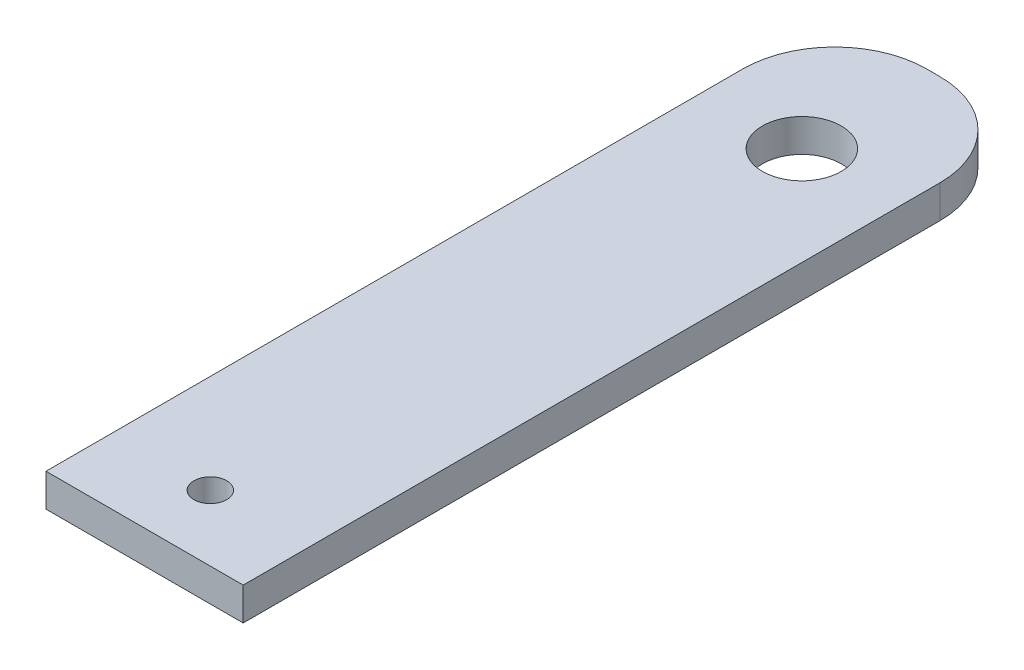
from build123d import *

# Parameters (mm, degrees)
STEM_START                = 1.006990195
STEM_OTHER_SIDE_OUTLINE_R = 3.81
STEM_OTHER_SIDE_DEPTH     = 3.175
SKETCH1_R                 = 1.5875
CUT_EXTRUDE1_DEPTH        = 3.175


# Read off the part's stored shape, not the designer's step: Stem Other Side
with BuildPart() as part:
    # Stem Other Side outline → Stem Other Side (new body)
    with BuildSketch(Plane(origin=(0, 0, 0), x_dir=(1, 0, 0), z_dir=(0, 1, 0)).offset(STEM_START)):
        with BuildLine():
            Line((-20.453203013, 27.656176961), (-21.723203013, 27.656176961))
            ThreePointArc((-21.723203013, 27.656176961), (-28.009382298, 25.052356246), (-30.613203013, 18.766176961))
            Line((-30.613203013, 18.766176961), (-30.613203013, -48.543823039))
            Line((-30.613203013, -48.543823039), (-11.563203013, -48.543823039))
            Line((-11.563203013, -48.543823039), (-11.563203013, 18.766176961))
            ThreePointArc((-11.563203013, 18.766176961), (-14.167023728, 25.052356246), (-20.453203013, 27.656176961))
        make_face()
        with Locations((-21.088203013, 14.956176961)):
            Circle(STEM_OTHER_SIDE_OUTLINE_R, mode=Mode.SUBTRACT)
    extrude(amount=STEM_OTHER_SIDE_DEPTH)

    # Sketch1 → Cut-Extrude1 (cut)
    with BuildSketch(Plane(origin=(0, 4.181990195, 0), x_dir=(1, 0, 0), z_dir=(0, 1, 0))):
        with Locations(Location((-21.088203013, -42.193823039, 0), (0, 0, 270))):
            Circle(SKETCH1_R)
    extrude(amount=-CUT_EXTRUDE1_DEPTH, mode=Mode.SUBTRACT)


solid = part.part
